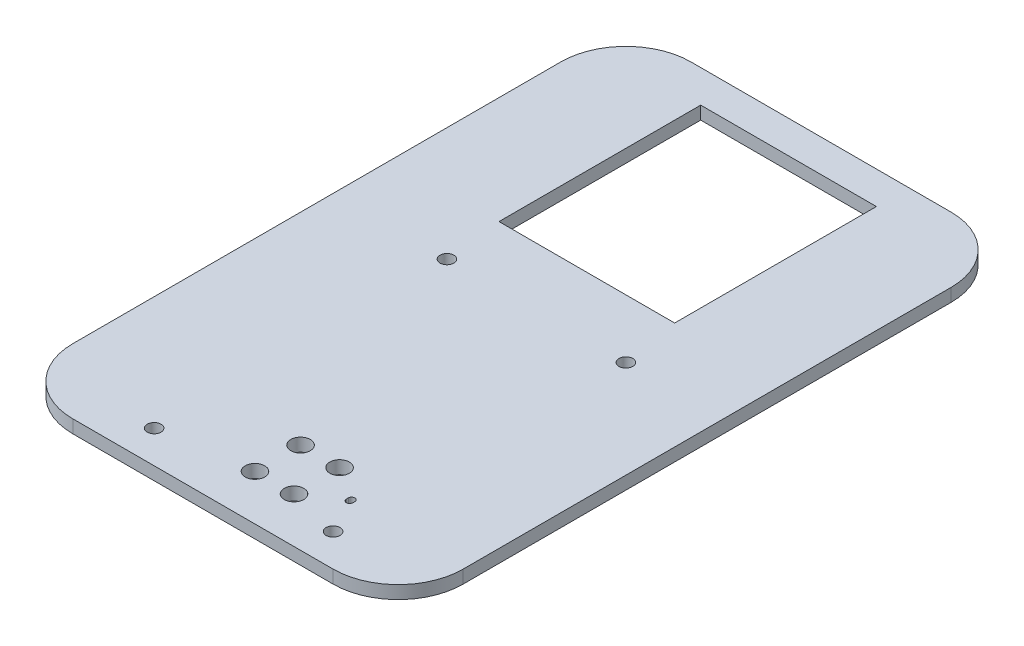
from build123d import *

# Parameters (mm, degrees)
TOP_DEPTH                 = 2.54
SKETCH7_R                 = 1.905
BUTTONLEDCUT_DEPTH        = 72.394448138
SKETCH8_W                 = 34.29
SKETCH8_H                 = 39.37
SOLARCUT_DEPTH            = 72.394448138
F_6_32_TAPPED_HOLE1_D     = 2.7051
F_6_32_TAPPED_HOLE1_DEPTH = 11.176
F_6_32_TAPPED_HOLE1_TIP   = 0.81269403


with BuildPart() as part:
    # Sketch2 → top (new body)
    with BuildSketch(Plane(origin=(0, 0, 0), x_dir=(1, 0, 0), z_dir=(0, 1, 0))):
        with BuildLine():
            Line((-25.4, -60.325), (25.4, -60.325))
            ThreePointArc((25.4, -60.325), (34.380256121, -56.605256121), (38.1, -47.625))
            Line((38.1, -47.625), (38.1, 47.625))
            ThreePointArc((38.1, 47.625), (34.380256121, 56.605256121), (25.4, 60.325))
            Line((25.4, 60.325), (-25.4, 60.325))
            ThreePointArc((-25.4, 60.325), (-34.380256121, 56.605256121), (-38.1, 47.625))
            Line((-38.1, 47.625), (-38.1, -47.625))
            ThreePointArc((-38.1, -47.625), (-34.380256121, -56.605256121), (-25.4, -60.325))
        make_face()
    extrude(amount=TOP_DEPTH)

    # Sketch7 → ButtonLEDCut (cut, through all)
    with BuildSketch(Plane(origin=(0, 2.54, 0), x_dir=(1, 0, 0), z_dir=(0, 1, 0))):
        with Locations((1.27, -51.435)):
            Circle(SKETCH7_R)
        with Locations((8.89, -51.435)):
            Circle(SKETCH7_R)
        with Locations((8.89, -42.545)):
            Circle(SKETCH7_R)
        with Locations((1.27, -42.545)):
            Circle(SKETCH7_R)
        with BuildLine():
            Line((16.129, -46.7995), (16.129, -47.1805))
            ThreePointArc((16.129, -47.1805), (15.494, -47.8155), (14.859, -47.1805))
            Line((14.859, -47.1805), (14.859, -46.7995))
            ThreePointArc((14.859, -46.7995), (15.494, -46.1645), (16.129, -46.7995))
        make_face()
    extrude(amount=-BUTTONLEDCUT_DEPTH, mode=Mode.SUBTRACT)

    # Sketch8 → SolarCut (cut, through all)
    with BuildSketch(Plane(origin=(0, 2.54, 0), x_dir=(1, 0, 0), z_dir=(0, 1, 0))):
        with Locations((0, 34.29)):
            Rectangle(SKETCH8_W, SKETCH8_H)
    extrude(amount=-SOLARCUT_DEPTH, mode=Mode.SUBTRACT)

    # #6-32 Tapped Hole1
    with Locations(Plane(origin=(0, 2.54, 0), x_dir=(1, 0, 0), z_dir=(0, 1, 0))):
        with Locations((-15.875, 3.175), (19.05, 3.175), (19.05, -53.975), (-15.875, -53.975)):
            Hole(F_6_32_TAPPED_HOLE1_D / 2, depth=F_6_32_TAPPED_HOLE1_DEPTH)
            with Locations((0, 0, -(F_6_32_TAPPED_HOLE1_DEPTH + F_6_32_TAPPED_HOLE1_TIP / 2))):  # 118° drill point
                Cone(0, F_6_32_TAPPED_HOLE1_D / 2, F_6_32_TAPPED_HOLE1_TIP, mode=Mode.SUBTRACT)


solid = part.part
